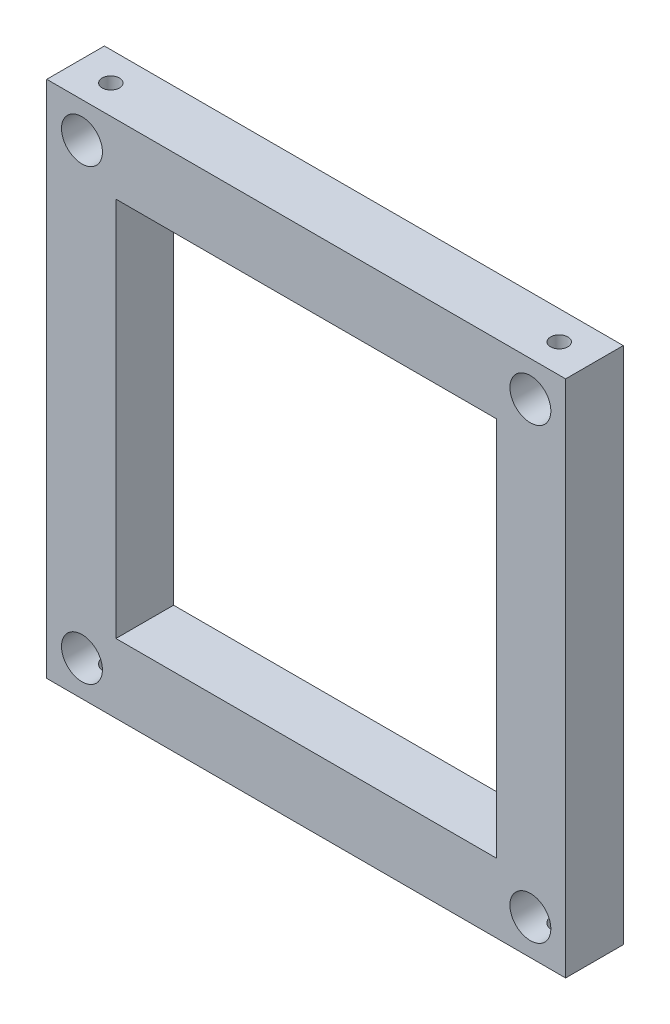
from build123d import *

# Parameters (mm, degrees)
SKETCH1_W           = 90
SKETCH1_H           = 90
SKETCH1_R           = 3.55
SKETCH1_W_2         = 66
SKETCH1_H_2         = 66
BOSS_EXTRUDE1_DEPTH = 10
CUT_EXTRUDE1_REACH  = 103.119
SKETCH2_R           = 1.5


with BuildPart() as part:
    # Sketch1 → Boss-Extrude1 (new body)
    with BuildSketch(Plane.XY):
        Rectangle(SKETCH1_W, SKETCH1_H)
        with Locations((-38.89, 38.891745911)):
            Circle(SKETCH1_R, mode=Mode.SUBTRACT)
        with Locations((38.89, 38.891745911)):
            Circle(SKETCH1_R, mode=Mode.SUBTRACT)
        with Locations((38.89, -38.891745911)):
            Circle(SKETCH1_R, mode=Mode.SUBTRACT)
        with Locations((-38.89, -38.891745911)):
            Circle(SKETCH1_R, mode=Mode.SUBTRACT)
        Rectangle(SKETCH1_W_2, SKETCH1_H_2, mode=Mode.SUBTRACT)
    extrude(amount=BOSS_EXTRUDE1_DEPTH)

    # Sketch2 → Cut-Extrude1 (cut, up to next)
    with BuildSketch(Plane.XZ.offset(45), mode=Mode.PRIVATE) as cut_extrude1_sk1:
        with Locations((-38.89, 5)):
            Circle(SKETCH2_R)
    cut_extrude1_tool1 = extrude(cut_extrude1_sk1.sketch, amount=-CUT_EXTRUDE1_REACH, mode=Mode.PRIVATE) & part.part
    # Sketch2 → Cut-Extrude1 (cut, up to next)
    with BuildSketch(Plane.XZ.offset(45), mode=Mode.PRIVATE) as cut_extrude1_sk2:
        with Locations((38.89, 5)):
            Circle(SKETCH2_R)
    cut_extrude1_tool2 = extrude(cut_extrude1_sk2.sketch, amount=-CUT_EXTRUDE1_REACH, mode=Mode.PRIVATE) & part.part
    cut_extrude1_1 = cut_extrude1_tool1.solids().sort_by_distance((-38.89, -45, 5))[0]
    add(cut_extrude1_1, mode=Mode.SUBTRACT)
    cut_extrude1_2 = cut_extrude1_tool2.solids().sort_by_distance((38.89, -45, 5))[0]
    add(cut_extrude1_2, mode=Mode.SUBTRACT)
    cut_extrude1 = cut_extrude1_1 + cut_extrude1_2  # Cut-Extrude1 as one shape, for the pattern or mirror that repeats it

    # Mirror1: Cut-Extrude1 across plane
    add(cut_extrude1.mirror(Plane.ZX), mode=Mode.SUBTRACT)


solid = part.part
